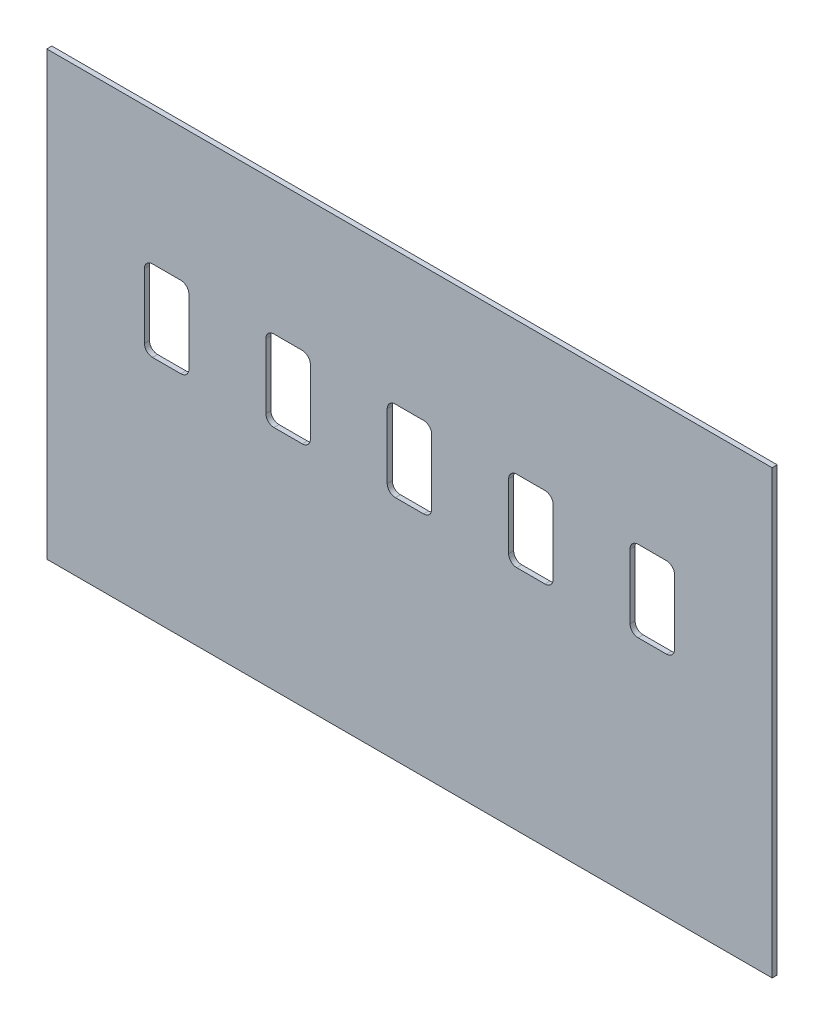
from build123d import *

# Parameters (mm, degrees)
SKETCH3_W           = 455.295
SKETCH3_H           = 277.368
BOSS_EXTRUDE1_DEPTH = 1.5875
CUT_EXTRUDE1_DEPTH  = 25.4


with BuildPart() as part:
    # Sketch3 → Boss-Extrude1 (new, symmetric)
    with BuildSketch(Plane.XY):
        Rectangle(SKETCH3_W, SKETCH3_H)
    extrude(amount=BOSS_EXTRUDE1_DEPTH, both=True)

    # Sketch4 → Cut-Extrude1 (cut)
    with BuildSketch(Plane.XY.offset(1.5875)):
        with BuildLine():
            Line((-161.29, 54.991001016), (-143.51, 54.991001016))
            ThreePointArc((-143.51, 54.991001016), (-139.917897552, 53.503103464), (-138.43, 49.911001016))
            Line((-138.43, 49.911001016), (-138.43, 9.271001016))
            ThreePointArc((-138.43, 9.271001016), (-139.917897552, 5.678898568), (-143.51, 4.191001016))
            Line((-143.51, 4.191001016), (-161.29, 4.191001016))
            ThreePointArc((-161.29, 4.191001016), (-164.882102448, 5.678898568), (-166.37, 9.271001016))
            Line((-166.37, 9.271001016), (-166.37, 49.911001016))
            ThreePointArc((-166.37, 49.911001016), (-164.882102448, 53.503103464), (-161.29, 54.991001016))
        make_face()
        with BuildLine():
            Line((-8.89, 54.991001016), (8.89, 54.991001016))
            ThreePointArc((8.89, 54.991001016), (12.482102448, 53.503103464), (13.97, 49.911001016))
            Line((13.97, 49.911001016), (13.97, 9.271001016))
            ThreePointArc((13.97, 9.271001016), (12.482102448, 5.678898568), (8.89, 4.191001016))
            Line((8.89, 4.191001016), (-8.89, 4.191001016))
            ThreePointArc((-8.89, 4.191001016), (-12.482102448, 5.678898568), (-13.97, 9.271001016))
            Line((-13.97, 9.271001016), (-13.97, 49.911001016))
            ThreePointArc((-13.97, 49.911001016), (-12.482102448, 53.503103464), (-8.89, 54.991001016))
        make_face()
        with BuildLine():
            Line((67.31, 54.991001016), (85.09, 54.991001016))
            ThreePointArc((85.09, 54.991001016), (88.682102448, 53.503103464), (90.17, 49.911001016))
            Line((90.17, 49.911001016), (90.17, 9.271001016))
            ThreePointArc((90.17, 9.271001016), (88.682102448, 5.678898568), (85.09, 4.191001016))
            Line((85.09, 4.191001016), (67.31, 4.191001016))
            ThreePointArc((67.31, 4.191001016), (63.717897552, 5.678898568), (62.23, 9.271001016))
            Line((62.23, 9.271001016), (62.23, 49.911001016))
            ThreePointArc((62.23, 49.911001016), (63.717897552, 53.503103464), (67.31, 54.991001016))
        make_face()
        with BuildLine():
            Line((143.51, 54.991001016), (161.29, 54.991001016))
            ThreePointArc((161.29, 54.991001016), (164.882102448, 53.503103464), (166.37, 49.911001016))
            Line((166.37, 49.911001016), (166.37, 9.271001016))
            ThreePointArc((166.37, 9.271001016), (164.882102448, 5.678898568), (161.29, 4.191001016))
            Line((161.29, 4.191001016), (143.51, 4.191001016))
            ThreePointArc((143.51, 4.191001016), (139.917897552, 5.678898568), (138.43, 9.271001016))
            Line((138.43, 9.271001016), (138.43, 49.911001016))
            ThreePointArc((138.43, 49.911001016), (139.917897552, 53.503103464), (143.51, 54.991001016))
        make_face()
        with BuildLine():
            Line((-85.09, 54.991001016), (-67.31, 54.991001016))
            ThreePointArc((-67.31, 54.991001016), (-63.717897552, 53.503103464), (-62.23, 49.911001016))
            Line((-62.23, 49.911001016), (-62.23, 9.271001016))
            ThreePointArc((-62.23, 9.271001016), (-63.717897552, 5.678898568), (-67.31, 4.191001016))
            Line((-67.31, 4.191001016), (-85.09, 4.191001016))
            ThreePointArc((-85.09, 4.191001016), (-88.682102448, 5.678898568), (-90.17, 9.271001016))
            Line((-90.17, 9.271001016), (-90.17, 49.911001016))
            ThreePointArc((-90.17, 49.911001016), (-88.682102448, 53.503103464), (-85.09, 54.991001016))
        make_face()
    extrude(amount=-CUT_EXTRUDE1_DEPTH, mode=Mode.SUBTRACT)


solid = part.part
